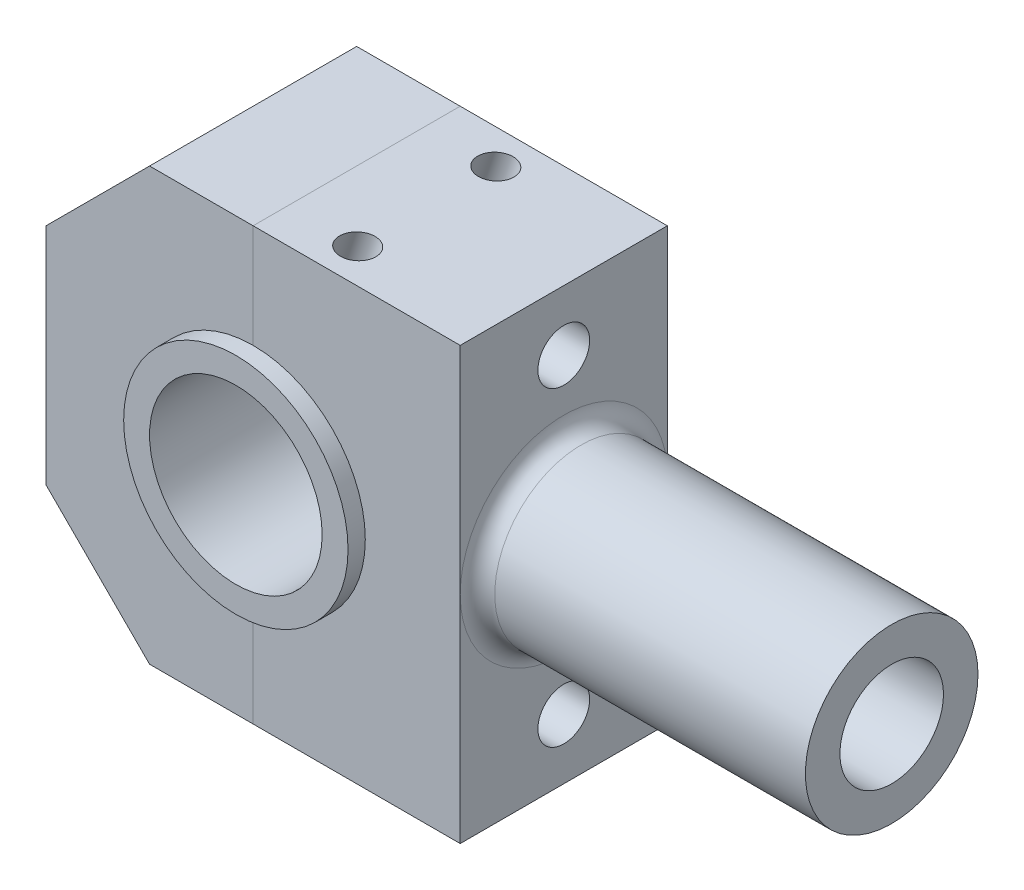
from build123d import *

# Parameters (mm, degrees)
BOSS_EXTRUDE1_DEPTH     = 6
BOSS_EXTRUDE2_DEPTH     = 6
SKETCH2_R               = 5
SKETCH2_R_2             = 3
BOSS_EXTRUDE3_DEPTH     = 19
SKETCH2_3_R             = 1.5
CUT_EXTRUDE1_DEPTH      = 18
BOSS_EXTRUDE4_DEPTH     = 7
CUT_EXTRUDE2_REACH      = 40.49
CUT_EXTRUDE2_END_RADIUS = 5
SKETCH3_R               = 1
FILLET1_R               = 1


with BuildPart() as part:
    # Sketch1 → Boss-Extrude1 (new, symmetric)
    with BuildSketch(Plane.XY):
        with BuildLine():
            Line((12, 12.5), (0, 12.5))
            Line((0, 12.5), (0, 6.5))
            ThreePointArc((0, 6.5), (4.596194078, 4.596194078), (6.5, 0))
            ThreePointArc((6.5, 0), (4.596194078, -4.596194078), (0, -6.5))
            Line((0, -6.5), (0, -12.5))
            Line((0, -12.5), (12, -12.5))
            Line((12, -12.5), (12, 12.5))
        make_face()
    extrude(amount=BOSS_EXTRUDE1_DEPTH, both=True)

    # Sketch2 → Boss-Extrude3 (add)
    with BuildSketch(Plane(origin=(12, 0, 0), x_dir=(0, 0, -1), z_dir=(1, 0, 0))):
        Circle(SKETCH2_R)
        Circle(SKETCH2_R_2, mode=Mode.SUBTRACT)
    extrude(amount=BOSS_EXTRUDE3_DEPTH)


with BuildPart() as body_2:
    # Sketch1<3> → Boss-Extrude2 (new, symmetric)
    with BuildSketch(Plane.XY):
        with BuildLine():
            Line((0, 6.5), (0, 12.5))
            Line((0, 12.5), (-6, 12.5))
            Line((-6, 12.5), (-12, 6.5))
            Line((-12, 6.5), (-12, -6.5))
            Line((-12, -6.5), (-6, -12.5))
            Line((-6, -12.5), (0, -12.5))
            Line((0, -12.5), (0, -6.5))
            ThreePointArc((0, -6.5), (-6.5, 0), (0, 6.5))
        make_face()
    extrude(amount=BOSS_EXTRUDE2_DEPTH, both=True)


with BuildPart() as cut_extrude1_tool:
    # Sketch2<3> → Cut-Extrude1 (new body)
    with BuildSketch(Plane(origin=(12, 0, 0), x_dir=(0, 0, -1), z_dir=(1, 0, 0))):
        with Locations((0, 9)):
            Circle(SKETCH2_3_R)
        with Locations((0, -9)):
            Circle(SKETCH2_3_R)
    extrude(amount=-CUT_EXTRUDE1_DEPTH)


with BuildPart() as part_1:
    add(part.part)

    # Cut-Extrude1: cut by cut_extrude1_tool
    add(cut_extrude1_tool.part, mode=Mode.SUBTRACT)


with BuildPart() as body_2_1:
    add(body_2.part)

    # Cut-Extrude1: cut by cut_extrude1_tool
    add(cut_extrude1_tool.part, mode=Mode.SUBTRACT)


with BuildPart() as body_3:
    # Sketch1<4> → Boss-Extrude4 (new, symmetric)
    with BuildSketch(Plane.XY):
        with BuildLine():
            ThreePointArc((6.5, 0), (4.596194078, 4.596194078), (0, 6.5))
            Line((0, 6.5), (0, 5))
            ThreePointArc((0, 5), (3.535533906, 3.535533906), (5, 0))
            ThreePointArc((5, 0), (3.535533906, -3.535533906), (0, -5))
            Line((0, -5), (0, -6.5))
            ThreePointArc((0, -6.5), (4.596194078, -4.596194078), (6.5, 0))
        make_face()
        with BuildLine():
            Line((0, 5), (0, 6.5))
            ThreePointArc((0, 6.5), (-6.5, 0), (0, -6.5))
            Line((0, -6.5), (0, -5))
            ThreePointArc((0, -5), (-5, 0), (0, 5))
        make_face()
    extrude(amount=BOSS_EXTRUDE4_DEPTH, both=True)


with BuildPart() as cut_extrude2_tool:
    # Cut-Extrude2: up to this cylinder (the profile starts outside it)
    cut_extrude2_end = Plane(origin=(0, 0, 0), z_dir=(0, 0, -1)) * Cylinder(CUT_EXTRUDE2_END_RADIUS, 99.98, mode=Mode.PRIVATE)
    # Sketch3 → Cut-Extrude2 (new, up to the surface)
    with BuildSketch(Plane(origin=(4.819555861, 14.833067729, 0), x_dir=(0, 0, -1), z_dir=(0.3090169943749482, 0.9510565162951534, 0)), mode=Mode.PRIVATE) as cut_extrude2_sk1:
        with Locations(Location((-4, 0, 0), (0, 0, 90))):
            Circle(SKETCH3_R)
    cut_extrude2_tool1 = extrude(cut_extrude2_sk1.sketch, amount=-CUT_EXTRUDE2_REACH, mode=Mode.PRIVATE) - cut_extrude2_end
    add(cut_extrude2_tool1.solids().sort_by_distance((4.819556, 14.833068, 4))[0])
    # Sketch3 → Cut-Extrude2 (new, up to the surface)
    with BuildSketch(Plane(origin=(4.819555861, 14.833067729, 0), x_dir=(0, 0, -1), z_dir=(0.3090169943749482, 0.9510565162951534, 0)), mode=Mode.PRIVATE) as cut_extrude2_sk2:
        with Locations(Location((4, 0, 0), (0, 0, 90))):
            Circle(SKETCH3_R)
    cut_extrude2_tool2 = extrude(cut_extrude2_sk2.sketch, amount=-CUT_EXTRUDE2_REACH, mode=Mode.PRIVATE) - cut_extrude2_end
    add(cut_extrude2_tool2.solids().sort_by_distance((4.819556, 14.833068, -4))[0])


with BuildPart() as part_2:
    add(part_1.part)

    # Cut-Extrude2: cut by cut_extrude2_tool
    add(cut_extrude2_tool.part, mode=Mode.SUBTRACT)

    # Fillet1
    fillet1_edges = [part_2.edges().sort_by_distance(p)[0] for p in [
        (12, 0, 5),
    ]]
    fillet(fillet1_edges, radius=FILLET1_R - 0.0001)  # a hair under: the kernel refuses the full size


with BuildPart() as body_3_1:
    add(body_3.part)

    # Cut-Extrude2: cut by cut_extrude2_tool
    add(cut_extrude2_tool.part, mode=Mode.SUBTRACT)


solid = Compound([body_2_1.part, part_2.part, body_3_1.part])
